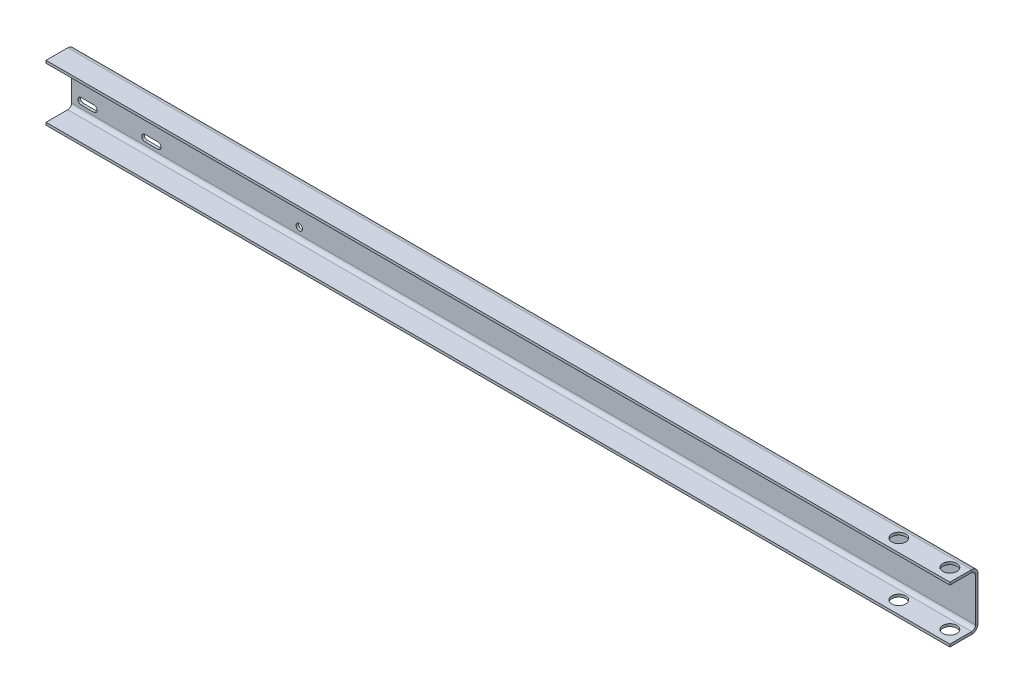
from build123d import *

# Parameters (mm, degrees)
SKETCH1_W                    = 1415
SKETCH1_H                    = 88
BASE_FLANGE1_DEPTH           = 4
EDGE_FLANGE1_STRIP_W         = 28
EDGE_FLANGE1_STRIP_H         = 4
EDGE_FLANGE1_STRIP_CUT_DEPTH = 1415
EDGE_FLANGE1_DEPTH           = 1415
EDGE_FLANGE2_STRIP_W         = 28
EDGE_FLANGE2_STRIP_H         = 4
EDGE_FLANGE2_STRIP_CUT_DEPTH = 1415
EDGE_FLANGE2_DEPTH           = 1415
CUT_EXTRUDE1_DEPTH           = 871.900176512
CUT_EXTRUDE1_DEPTH_BACK      = 871.900176512
SKETCH12_R                   = 11
CUT_EXTRUDE2_DEPTH           = 872.093059006
SKETCH16_R                   = 5
CUT_EXTRUDE4_DEPTH           = 10


# Sheet-metal steps are written as plain solids
with BuildPart() as part:
    # Sketch1 → Base-Flange1 (new body)
    with BuildSketch(Plane.XY):
        with Locations((-158.018987342, 44)):
            Rectangle(SKETCH1_W, SKETCH1_H)
    extrude(amount=-BASE_FLANGE1_DEPTH)

    # Edge-Flange1 strip (across the edge) → Edge-Flange1 strip cut (cut)
    with BuildSketch(Plane(origin=(549.481012658, 88, 0), x_dir=(0, -1, 0), z_dir=(-1, 0, 0))):
        with Locations((-4, -2)):
            Rectangle(EDGE_FLANGE1_STRIP_W, EDGE_FLANGE1_STRIP_H)
    extrude(amount=EDGE_FLANGE1_STRIP_CUT_DEPTH, mode=Mode.SUBTRACT)

    # Edge-Flange1 section (across the edge) → Edge-Flange1 (add)
    with BuildSketch(Plane(origin=(549.481012658, 88, 0), x_dir=(0, -1, 0), z_dir=(-1, 0, 0))):
        with BuildLine():
            Line((0, 6), (0, 40))
            Line((0, 40), (4, 40))
            Line((4, 40), (4, 6))
            ThreePointArc((4, 6), (5.757359313, 1.757359313), (10, 0))
            Line((10, 0), (10, -4))
            ThreePointArc((10, -4), (2.928932188, -1.071067812), (0, 6))
        make_face()
    extrude(amount=EDGE_FLANGE1_DEPTH)

    # Edge-Flange2 strip (across the edge) → Edge-Flange2 strip cut (cut)
    with BuildSketch(Plane.YZ.offset(-865.518987342)):
        with Locations((-4, -2)):
            Rectangle(EDGE_FLANGE2_STRIP_W, EDGE_FLANGE2_STRIP_H)
    extrude(amount=EDGE_FLANGE2_STRIP_CUT_DEPTH, mode=Mode.SUBTRACT)

    # Edge-Flange2 section (across the edge) → Edge-Flange2 (add)
    with BuildSketch(Plane.YZ.offset(-865.518987342)):
        with BuildLine():
            Line((0, 6), (0, 40))
            Line((0, 40), (4, 40))
            Line((4, 40), (4, 6))
            ThreePointArc((4, 6), (5.757359313, 1.757359313), (10, 0))
            Line((10, 0), (10, -4))
            ThreePointArc((10, -4), (2.928932188, -1.071067812), (0, 6))
        make_face()
    extrude(amount=EDGE_FLANGE2_DEPTH)

    # Sketch12 → Cut-Extrude1 (cut, two sides: drawn at the far end of the back side and taken through both)
    with BuildSketch(Plane.XZ.offset(-CUT_EXTRUDE1_DEPTH_BACK)):
        with Locations(Location((529.481012658, 20, 0), (0, 0, 270))):
            Circle(SKETCH12_R)
        with Locations(Location((449.481012658, 20, 0), (0, 0, 270))):
            Circle(SKETCH12_R)
    extrude(amount=CUT_EXTRUDE1_DEPTH + CUT_EXTRUDE1_DEPTH_BACK, mode=Mode.SUBTRACT)

    # Sketch13 → Cut-Extrude2 (cut, through all)
    with BuildSketch(Plane(origin=(0, 0, -4), x_dir=(-1, 0, 0), z_dir=(0, 0, -1))):
        with BuildLine():
            Line((850.518987342, 15), (830.518987342, 15))
            ThreePointArc((830.518987342, 15), (825.518987342, 20), (830.518987342, 25))
            Line((830.518987342, 25), (850.518987342, 25))
            ThreePointArc((850.518987342, 25), (855.518987342, 20), (850.518987342, 15))
        make_face()
        with BuildLine():
            Line((750.518987342, 15), (730.518987342, 15))
            ThreePointArc((730.518987342, 15), (725.518987342, 20), (730.518987342, 25))
            Line((730.518987342, 25), (750.518987342, 25))
            ThreePointArc((750.518987342, 25), (755.518987342, 20), (750.518987342, 15))
        make_face()
    extrude(amount=-CUT_EXTRUDE2_DEPTH, mode=Mode.SUBTRACT)

    # Sketch16 → Cut-Extrude4 (cut)
    with BuildSketch(Plane(origin=(0, 0, -4), x_dir=(-1, 0, 0), z_dir=(0, 0, -1))):
        with Locations((509.018987342, 20)):
            Circle(SKETCH16_R)
    extrude(amount=-CUT_EXTRUDE4_DEPTH, mode=Mode.SUBTRACT)


solid = part.part
